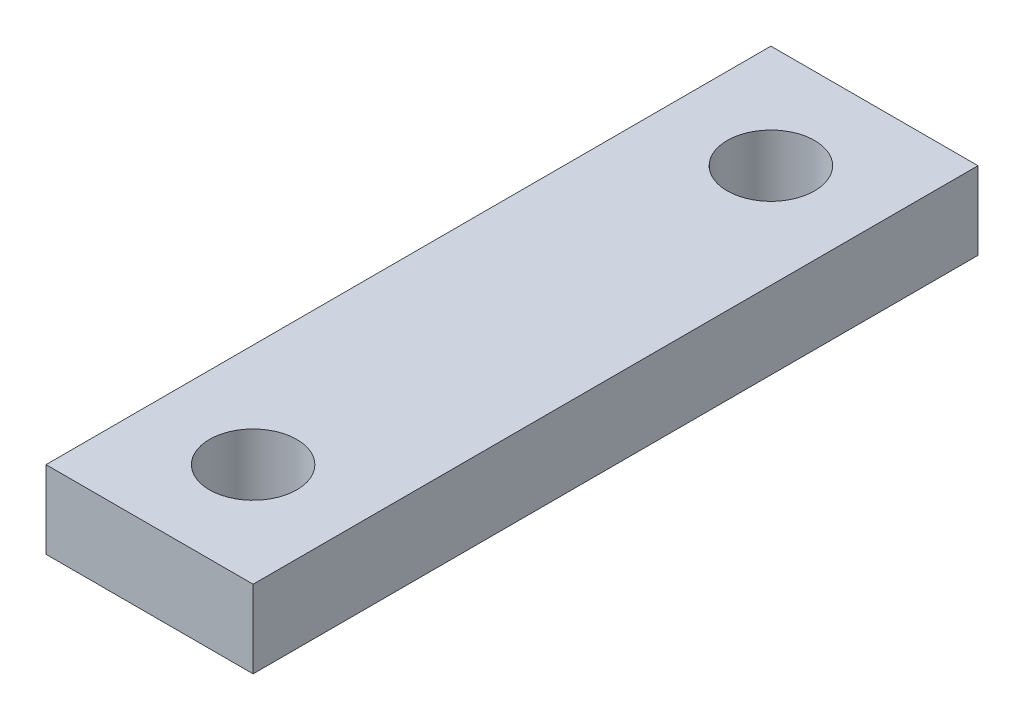
from build123d import *

# Parameters (mm, degrees)
SKETCH1_W                   = 25.4
SKETCH1_H                   = 9.525
EXTRUDE1_DEPTH              = 44.45
TAP_DRILL_FOR_1_2_13_TAP1_D = 10.71626


with BuildPart() as part:
    # Sketch1 → Extrude1 (new, symmetric)
    with BuildSketch(Plane.XY):
        Rectangle(SKETCH1_W, SKETCH1_H)
    extrude(amount=EXTRUDE1_DEPTH, both=True)

    # Tap Drill for 1/2-13 Tap1 (through all)
    with Locations(Plane(origin=(0, 4.7625, -31.75), x_dir=(0, 0, 1), z_dir=(0, 1, 0))):
        with Locations((0, 0)):
            tap_drill_for_1_2_13_tap1 = Hole(TAP_DRILL_FOR_1_2_13_TAP1_D / 2)

    # Mirror1: Tap Drill for 1/2-13 Tap1 across plane
    add(tap_drill_for_1_2_13_tap1.mirror(Plane.XY), mode=Mode.SUBTRACT)


solid = part.part
